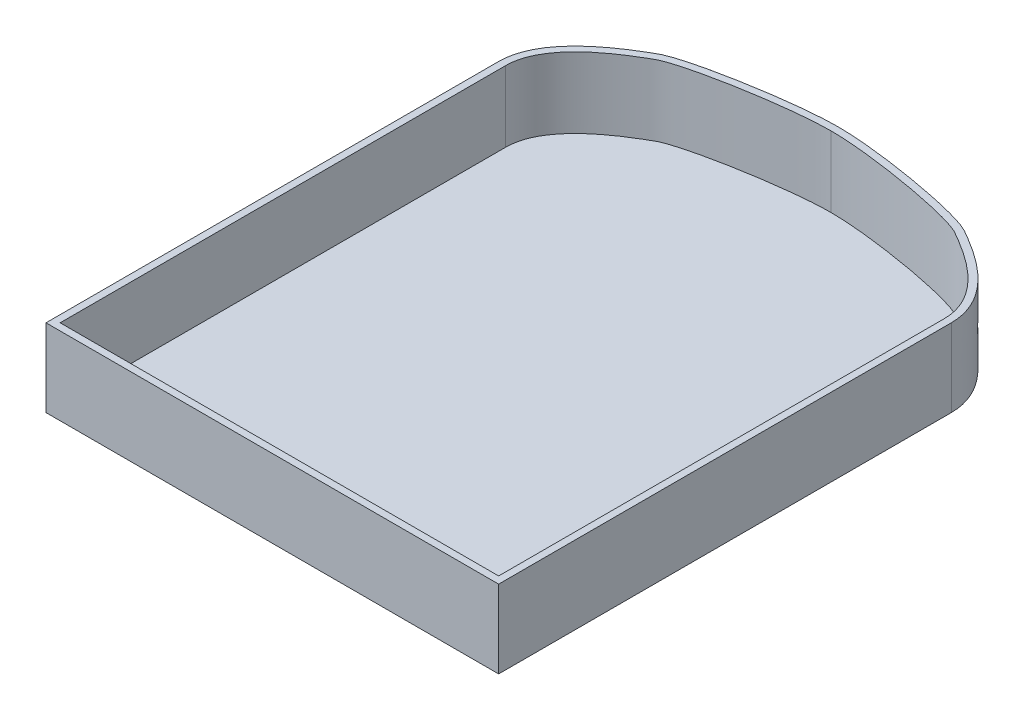
from build123d import *

# Parameters (mm, degrees)
BOSS_EXTRUDE1_DEPTH = 2.5
BOSS_EXTRUDE2_DEPTH = 25


with BuildPart() as part:
    # Sketch1 → Boss-Extrude1 (new body)
    with BuildSketch(Plane(origin=(0, 0, 0), x_dir=(1, 0, 0), z_dir=(0, 1, 0))):
        with BuildLine():
            Line((80, 80), (80, -80))
            Line((80, -80), (-80, -80))
            Line((-80, -80), (-80, 80))
            add(Edge.make_bspline(
                [(-80, 80), (-80, 95), (-57.958622688, 108.209351488), (-48.366821447, 114.052295793), (-15, 120), (0, 120)],
                knots=[0, 0, 0, 0, 0.166119912, 0.217303921, 0.511840086, 0.511840086, 0.511840086, 0.511840086], degree=3))
            add(Edge.make_bspline(
                [(80, 80), (80, 95), (57.958622688, 108.209351488), (48.366821447, 114.052295793), (15, 120), (0, 120)],
                knots=[0, 0, 0, 0, 0.166119912, 0.217303921, 0.511840086, 0.511840086, 0.511840086, 0.511840086], degree=3))
        make_face()
    extrude(amount=BOSS_EXTRUDE1_DEPTH)

    # Sketch3 → Boss-Extrude2 (add)
    with BuildSketch(Plane(origin=(0, 2.5, 0), x_dir=(1, 0, 0), z_dir=(0, 1, 0))):
        with BuildLine():
            Line((-80, 80), (-80, -80))
            Line((-80, -80), (80, -80))
            Line((80, -80), (80, 80))
            add(Edge.make_bspline(
                [(80, 80), (80, 95), (57.958622688, 108.209351488), (48.366821447, 114.052295793), (15, 120), (0, 120)],
                knots=[0, 0, 0, 0, 0.166119912, 0.217303921, 0.511840086, 0.511840086, 0.511840086, 0.511840086], degree=3))
            add(Edge.make_bspline(
                [(0, 120), (-15, 120), (-48.366821447, 114.052295793), (-57.958622688, 108.209351488), (-80, 95), (-80, 80)],
                knots=[0, 0, 0, 0, 0.294536165, 0.345720174, 0.511840086, 0.511840086, 0.511840086, 0.511840086], degree=3))
        make_face()
        with BuildLine():
            Line((-77.5, 80), (-77.5, -77.5))
            Line((-77.5, -77.5), (77.5, -77.5))
            Line((77.5, -77.5), (77.5, 80))
            add(Edge.make_bspline(
                [(77.5, 80), (77.5, 81.966338247), (77.169357161, 83.868350374), (76.399084032, 86.176417582), (76.226347371, 86.636415847), (75.85087263, 87.539379287), (75.648521493, 87.981933648), (75.002064124, 89.285525369), (74.518735471, 90.122602265), (73.46558064, 91.74391585), (72.895683079, 92.528108931), (71.98574345, 93.670742786), (71.672647524, 94.046601497), (71.034477492, 94.782129009), (70.708948733, 95.142425787), (69.052290338, 96.910287703), (67.635488859, 98.218576731), (64.673509183, 100.686392476), (63.127555194, 101.845020212), (60.736676013, 103.499588596), (59.926912949, 104.03747246), (58.297071221, 105.084448071), (57.475659252, 105.594055489), (56.238122511, 106.346879241), (55.82472194, 106.595920926), (54.99811067, 107.094410311), (54.585026196, 107.344127929), (53.754733305, 107.834744645), (53.337538761, 108.075673408), (52.487304137, 108.523647309), (52.053135882, 108.72827999), (51.167165341, 109.099837257), (50.716568201, 109.269338894), (49.807543388, 109.591597586), (49.348919952, 109.743936026), (47.964976887, 110.183688802), (47.031716063, 110.454121921), (45.152995067, 110.968901429), (44.2064307, 111.212992229), (42.312193659, 111.680335225), (41.363603495, 111.903730481), (38.514422202, 112.550099204), (36.610472506, 112.949620364), (30.888735639, 114.079139149), (27.06129361, 114.741718521), (19.383645673, 115.907920935), (15.533565032, 116.412418689), (9.734242676, 117.00017106), (7.797039787, 117.167490771), (3.910295824, 117.415974725), (1.961164474, 117.5), (0, 117.5)],
                knots=[0, 0, 0, 0, 0.0625, 0.0625, 0.078125, 0.078125, 0.09375, 0.09375, 0.125, 0.125, 0.15625, 0.15625, 0.171875, 0.171875, 0.1875, 0.1875, 0.25, 0.25, 0.3125, 0.3125, 0.34375, 0.34375, 0.375, 0.375, 0.390625, 0.390625, 0.40625, 0.40625, 0.421875, 0.421875, 0.4375, 0.4375, 0.453125, 0.453125, 0.46875, 0.46875, 0.5, 0.5, 0.53125, 0.53125, 0.5625, 0.5625, 0.625, 0.625, 0.75, 0.75, 0.875, 0.875, 0.9375, 0.9375, 1, 1, 1, 1], degree=3))
            add(Edge.make_bspline(
                [(0, 117.5), (-1.965791646, 117.5), (-3.91940999, 117.415599466), (-7.815012094, 117.166132914), (-9.756579712, 116.998181688), (-15.568872471, 116.408285723), (-19.427437811, 115.902034057), (-27.121811483, 114.731750704), (-30.957496376, 114.066863184), (-36.691329889, 112.932989695), (-38.59926677, 112.531868183), (-41.454309797, 111.88260791), (-42.404833713, 111.658165407), (-44.302875612, 111.188439512), (-45.251813712, 110.94289002), (-47.13482657, 110.424683304), (-48.06969339, 110.152400484), (-49.454484253, 109.709220579), (-49.913127722, 109.555631349), (-50.82130213, 109.230364731), (-51.27103627, 109.059090697), (-52.153440338, 108.682670578), (-52.584836306, 108.474995714), (-53.429549589, 108.023760295), (-53.844112058, 107.782671341), (-54.669584862, 107.293244036), (-55.080420888, 107.044758182), (-55.902669765, 106.54893146), (-56.313824453, 106.301078144), (-58.364706994, 105.052103242), (-59.988356952, 104.019067425), (-62.37215636, 102.366939018), (-63.159851091, 101.798609872), (-64.704462662, 100.630698195), (-65.462124882, 100.030722285), (-67.684201803, 98.175099265), (-69.09878069, 96.864931736), (-70.749190635, 95.098334092), (-71.07329786, 94.738478167), (-71.708286776, 94.004297573), (-72.019734684, 93.629229851), (-72.92578582, 92.487766111), (-73.49329812, 91.704195259), (-74.542019509, 90.083660138), (-75.023301834, 89.246741178), (-75.881335584, 87.508232872), (-76.259097738, 86.600809102), (-77.171848847, 83.85076678), (-77.5, 81.959356572), (-77.5, 80)],
                knots=[0, 0, 0, 0, 0.0625, 0.0625, 0.125, 0.125, 0.25, 0.25, 0.375, 0.375, 0.4375, 0.4375, 0.46875, 0.46875, 0.5, 0.5, 0.53125, 0.53125, 0.546875, 0.546875, 0.5625, 0.5625, 0.578125, 0.578125, 0.59375, 0.59375, 0.609375, 0.609375, 0.625, 0.625, 0.6875, 0.6875, 0.71875, 0.71875, 0.75, 0.75, 0.8125, 0.8125, 0.828125, 0.828125, 0.84375, 0.84375, 0.875, 0.875, 0.90625, 0.90625, 0.9375, 0.9375, 1, 1, 1, 1], degree=3))
        make_face(mode=Mode.SUBTRACT)
    extrude(amount=BOSS_EXTRUDE2_DEPTH)


solid = part.part
